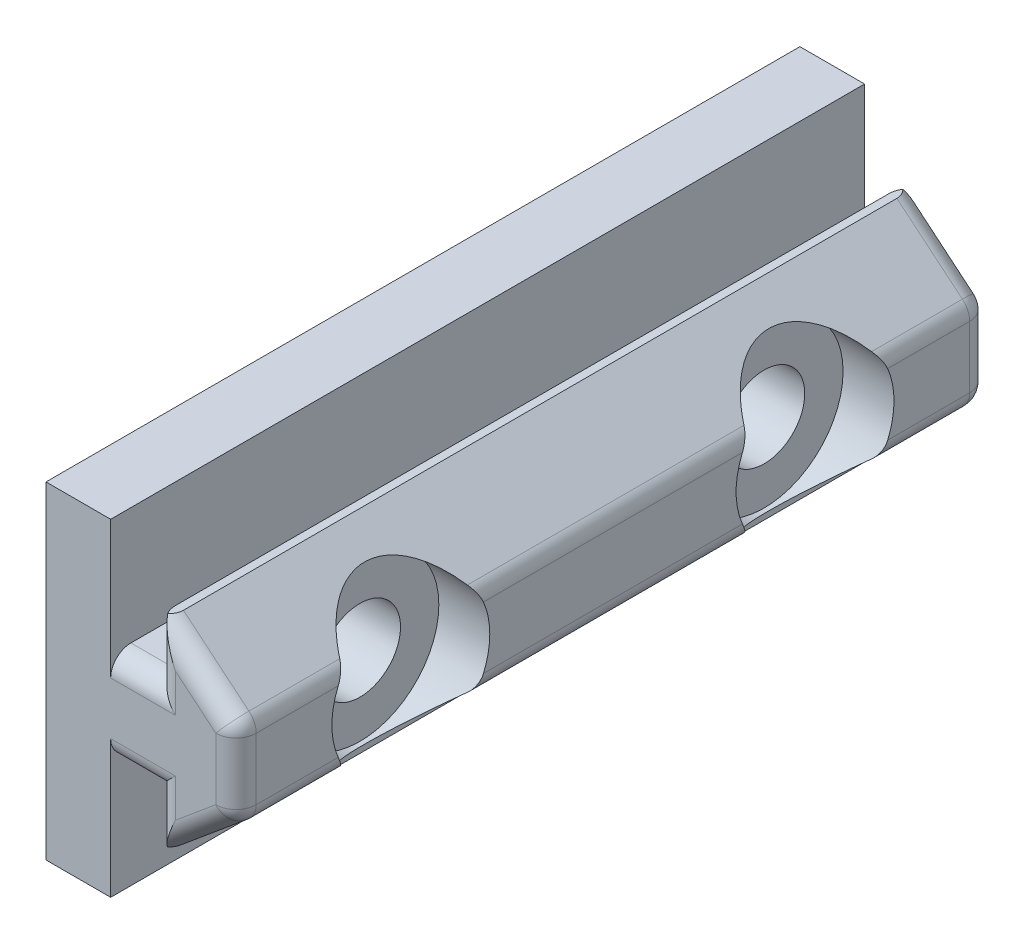
from build123d import *

# Parameters (mm, degrees)
BOSS_EXTRUDE1_DEPTH                             = 47.371
SKETCH2_W                                       = 6.858
SKETCH2_H                                       = 3.429
CUT_EXTRUDE1_DEPTH                              = 49.438972089
SKETCH3_W                                       = 4.064
SKETCH3_H                                       = 47.371
BOSS_EXTRUDE2_DEPTH                             = 7.366
SKETCH4_W                                       = 6.858
SKETCH4_H                                       = 3.429
CUT_EXTRUDE2_DEPTH                              = 50.110425431
SKETCH5_W                                       = 4.064
SKETCH5_H                                       = 47.371
BOSS_EXTRUDE3_DEPTH                             = 7.366
F_3_CLEARANCE_HOLE1_D                           = 2.7686
CBORE_FOR_10_BUTTON_HEAD_CAP_SCREW1_D           = 5.1054
CBORE_FOR_10_BUTTON_HEAD_CAP_SCREW1_CBORE_D     = 9.92124
CBORE_FOR_10_BUTTON_HEAD_CAP_SCREW1_CBORE_DEPTH = 3.2004
FILLET1_R                                       = 1.27
FILLET3_R                                       = 1.27
FILLET5_R                                       = 1.27


with BuildPart() as part:
    # Sketch1 → Boss-Extrude1 (new body)
    with BuildSketch(Plane.XY.offset(23.6855)):
        Polygon((3.302, 6.35), (-4.064, 6.35), (-4.064, -6.35), (3.302, -6.35), (7.874, -2.54), (7.874, 2.54), align=None)
    extrude(amount=-BOSS_EXTRUDE1_DEPTH)

    # Sketch2 → Cut-Extrude1 (cut, through all)
    with BuildSketch(Plane.XY.offset(23.6855)):
        with Locations((-0.635, 4.6355)):
            Rectangle(SKETCH2_W, SKETCH2_H)
    extrude(amount=-CUT_EXTRUDE1_DEPTH, mode=Mode.SUBTRACT)

    # Sketch3 → Boss-Extrude2 (add)
    with BuildSketch(Plane(origin=(0, 2.921, 0), x_dir=(-1, 0, 0), z_dir=(0, 1, 0))):
        with Locations((2.032, 0)):
            Rectangle(SKETCH3_W, SKETCH3_H)
    extrude(amount=BOSS_EXTRUDE2_DEPTH)

    # Sketch4 → Cut-Extrude2 (cut, through all)
    with BuildSketch(Plane.XY.offset(23.6855)):
        with Locations((-0.635, -4.6355)):
            Rectangle(SKETCH4_W, SKETCH4_H)
    extrude(amount=-CUT_EXTRUDE2_DEPTH, mode=Mode.SUBTRACT)

    # Sketch5 → Boss-Extrude3 (add)
    with BuildSketch(Plane.XZ.offset(2.921)):
        with Locations((-2.032, 0)):
            Rectangle(SKETCH5_W, SKETCH5_H)
    extrude(amount=BOSS_EXTRUDE3_DEPTH)

    # #3 Clearance Hole1 (through all)
    with Locations(Plane.ZY.offset(4.064)):
        with Locations((12.7, 0), (-12.7, 0)):
            Hole(F_3_CLEARANCE_HOLE1_D / 2)

    # CBORE for #10 Button Head Cap Screw1 (through all)
    with Locations(Plane(origin=(7.874, 0, 0), x_dir=(0, 0, -1), z_dir=(1, 0, 0))):
        with Locations((-12.7, 0), (12.7, 0)):
            CounterBoreHole(CBORE_FOR_10_BUTTON_HEAD_CAP_SCREW1_D / 2, CBORE_FOR_10_BUTTON_HEAD_CAP_SCREW1_CBORE_D / 2, CBORE_FOR_10_BUTTON_HEAD_CAP_SCREW1_CBORE_DEPTH)

    # Fillet1
    fillet1_edges = [part.edges().sort_by_distance(p)[0] for p in [
        (7.874, -2.54, 20.323251747),
        (7.874, -2.54, -20.323251747),
        (7.874, -2.54, 0),
        (7.874, 2.54, 20.323251747),
        (7.874, 2.54, 0),
        (7.874, 2.54, -20.323251747),
    ]]
    fillet(fillet1_edges, radius=FILLET1_R)

    # Fillet3
    # the kernel refuses this fillet: 1.27 mm, written as the material it takes off along each edge
    with BuildSketch(Plane(origin=(0.862897437, -8.382585469, -23.6855), x_dir=(0, 0, 1), z_dir=(0.7682212795973759, 0.6401843996644799, 0)), Plane(origin=(7.417034188, 2.920804844, -23.6855), x_dir=(0, 0, 1), z_dir=(-0.7682212795973759, 0.6401843996644799, 0))) as fillet3_piece_1:
        with BuildLine():
            CenterArc((FILLET3_R, -FILLET3_R), FILLET3_R, 90, 90)
            Line((0, -FILLET3_R), (0, 0))
            Line((0, 0), (FILLET3_R, 0))
        make_face()
    extrude(amount=8.531574072, mode=Mode.SUBTRACT)
    with BuildSketch(Plane(origin=(6.604, -1.945163819, -23.6855), x_dir=(0.6401843996644796, -0.7682212795973762, 0), z_dir=(-0.7682212795973762, -0.6401843996644796, 0))) as fillet3_piece_2:
        with BuildLine():
            CenterArc((1.27 - FILLET3_R, FILLET3_R), FILLET3_R, 270, 90)
            Line((1.27, FILLET3_R), (1.27, 0))
            Line((1.27, 0), (1.27 - FILLET3_R, 0))
        make_face()
    revolve(axis=Axis((6.604, -1.945163819, -23.6855), (0, 0, 1)), revolution_arc=50.194428908, mode=Mode.SUBTRACT)
    with BuildSketch(Plane(origin=(6.604, 1.945163819, -23.6855), x_dir=(0.6401843996644799, 0.7682212795973757, 0), z_dir=(-0.7682212795973757, 0.6401843996644799, 0))) as fillet3_piece_3:
        with BuildLine():
            CenterArc((1.27 - FILLET3_R, -FILLET3_R), FILLET3_R, 0, 90)
            Line((1.27, -FILLET3_R), (1.27, 0))
            Line((1.27, 0), (1.27 - FILLET3_R, 0))
        make_face()
    revolve(axis=Axis((6.604, 1.945163819, -23.6855), (0, 0, -1)), revolution_arc=50.194428908, mode=Mode.SUBTRACT)
    with BuildSketch(Plane(origin=(2.794, -2.921, -23.6855), x_dir=(0, 0, 1), z_dir=(-1, 0, 0)), Plane(origin=(0, 2.921, -23.6855), x_dir=(0, 0, 1), z_dir=(1, 0, 0))) as fillet3_piece_4:
        with BuildLine():
            CenterArc((FILLET3_R, FILLET3_R), FILLET3_R, 180, 90)
            Line((0, FILLET3_R), (0, 0))
            Line((0, 0), (FILLET3_R, 0))
        make_face()
    extrude(amount=2.794, mode=Mode.SUBTRACT)
    with BuildSketch(Plane(origin=(2.794, 2.921, -23.6855), x_dir=(0, 0, 1), z_dir=(0, 1, 0)), Plane(origin=(2.794, -9.525, -23.6855), x_dir=(0, 0, 1), z_dir=(0, 1, 0))) as fillet3_piece_5:
        with BuildLine():
            CenterArc((FILLET3_R, FILLET3_R), FILLET3_R, 180, 90)
            Line((0, FILLET3_R), (0, 0))
            Line((0, 0), (FILLET3_R, 0))
        make_face()
    extrude(amount=6.604, mode=Mode.SUBTRACT)
    with BuildSketch(Plane(origin=(7.874, -1.945163819, -23.6855), x_dir=(-1, 0, 0), z_dir=(0, 1, 0))) as fillet3_piece_6:
        with BuildLine():
            CenterArc((FILLET3_R, FILLET3_R), FILLET3_R, 180, 90)
            Line((0, FILLET3_R), (0, 0))
            Line((0, 0), (FILLET3_R, 0))
        make_face()
    extrude(amount=3.890327637, mode=Mode.SUBTRACT)
    with BuildSketch(Plane(origin=(2.794, -9.525, -23.6855), x_dir=(0, 0, 1), z_dir=(0, 1, 0))) as fillet3_piece_7a_section:
        with BuildLine():
            CenterArc((FILLET3_R, FILLET3_R), FILLET3_R, 180, 90)
            Line((0, FILLET3_R), (0, 0))
            Line((0, 0), (FILLET3_R, 0))
        make_face()
    fillet3_piece_7a = extrude(amount=9.779, mode=Mode.PRIVATE)
    fillet3_piece_7a = split(fillet3_piece_7a, bisect_by=Plane(origin=(3.081521795, -2.921, -23.397978205), z_dir=(0, 1, 0)), keep=Keep.TOP, mode=Mode.PRIVATE)
    with BuildSketch(Plane(origin=(5.969, -2.921, -23.6855), x_dir=(0, 0, 1), z_dir=(-1, 0, 0))) as fillet3_piece_7b_section:
        with BuildLine():
            CenterArc((FILLET3_R, FILLET3_R), FILLET3_R, 180, 90)
            Line((0, FILLET3_R), (0, 0))
            Line((0, 0), (FILLET3_R, 0))
        make_face()
    fillet3_piece_7b = extrude(amount=5.969, mode=Mode.PRIVATE)
    fillet3_piece_7b = split(fillet3_piece_7b, bisect_by=Plane(origin=(2.794, -2.633478205, -23.397978205), z_dir=(1, 0, 0)), keep=Keep.TOP, mode=Mode.PRIVATE)
    fillet3_piece_7 = fillet3_piece_7a & fillet3_piece_7b
    add(fillet3_piece_7, mode=Mode.SUBTRACT)
    with BuildSketch(Plane(origin=(2.794, -0.254, -23.6855), x_dir=(0, 0, 1), z_dir=(0, 1, 0))) as fillet3_piece_8a_section:
        with BuildLine():
            CenterArc((FILLET3_R, FILLET3_R), FILLET3_R, 180, 90)
            Line((0, FILLET3_R), (0, 0))
            Line((0, 0), (FILLET3_R, 0))
        make_face()
    fillet3_piece_8a = extrude(amount=9.779, mode=Mode.PRIVATE)
    fillet3_piece_8a = split(fillet3_piece_8a, bisect_by=Plane(origin=(3.081521795, 2.921, -23.397978205), z_dir=(0, -1, 0)), keep=Keep.TOP, mode=Mode.PRIVATE)
    with BuildSketch(Plane(origin=(0, 2.921, -23.6855), x_dir=(0, 0, 1), z_dir=(1, 0, 0))) as fillet3_piece_8b_section:
        with BuildLine():
            CenterArc((FILLET3_R, FILLET3_R), FILLET3_R, 180, 90)
            Line((0, FILLET3_R), (0, 0))
            Line((0, 0), (FILLET3_R, 0))
        make_face()
    fillet3_piece_8b = extrude(amount=5.969, mode=Mode.PRIVATE)
    fillet3_piece_8b = split(fillet3_piece_8b, bisect_by=Plane(origin=(2.794, 2.633478205, -23.397978205), z_dir=(1, 0, 0)), keep=Keep.TOP, mode=Mode.PRIVATE)
    fillet3_piece_8 = fillet3_piece_8a & fillet3_piece_8b
    add(fillet3_piece_8, mode=Mode.SUBTRACT)

    # Fillet5
    # the kernel refuses this fillet: 1.27 mm, written as the material it takes off along each edge
    with BuildSketch(Plane(origin=(0.862897437, -8.382585469, 23.6855), x_dir=(-0.6401843996644799, 0.7682212795973759, 0), z_dir=(0.7682212795973759, 0.6401843996644799, 0)), Plane(origin=(7.417034188, 2.920804844, 23.6855), x_dir=(-0.6401843996644799, -0.7682212795973759, 0), z_dir=(-0.7682212795973759, 0.6401843996644799, 0))) as fillet5_piece_1:
        with BuildLine():
            CenterArc((FILLET5_R, -FILLET5_R), FILLET5_R, 90, 90)
            Line((0, -FILLET5_R), (0, 0))
            Line((0, 0), (FILLET5_R, 0))
        make_face()
    extrude(amount=8.531574072, mode=Mode.SUBTRACT)
    with BuildSketch(Plane(origin=(6.604, -1.945163819, 23.6855), x_dir=(1, 0, 0), z_dir=(0, 1, 0))) as fillet5_piece_2:
        with BuildLine():
            CenterArc((1.27 - FILLET5_R, FILLET5_R), FILLET5_R, 270, 90)
            Line((1.27, FILLET5_R), (1.27, 0))
            Line((1.27, 0), (1.27 - FILLET5_R, 0))
        make_face()
    revolve(axis=Axis((6.604, -1.945163819, 23.6855), (0, 0, -1)), revolution_arc=50.194428908, mode=Mode.SUBTRACT)
    with BuildSketch(Plane(origin=(6.604, 1.945163819, 23.6855), x_dir=(0.6401843996644799, 0.7682212795973757, 0), z_dir=(-0.7682212795973757, 0.6401843996644799, 0))) as fillet5_piece_3:
        with BuildLine():
            CenterArc((1.27 - FILLET5_R, FILLET5_R), FILLET5_R, 270, 90)
            Line((1.27, FILLET5_R), (1.27, 0))
            Line((1.27, 0), (1.27 - FILLET5_R, 0))
        make_face()
    revolve(axis=Axis((6.604, 1.945163819, 23.6855), (0, 0, -1)), revolution_arc=50.194428908, mode=Mode.SUBTRACT)
    with BuildSketch(Plane(origin=(2.794, 2.921, 23.6855), x_dir=(1, 0, 0), z_dir=(0, 1, 0)), Plane(origin=(2.794, -9.525, 23.6855), x_dir=(1, 0, 0), z_dir=(0, 1, 0))) as fillet5_piece_4:
        with BuildLine():
            CenterArc((FILLET5_R, FILLET5_R), FILLET5_R, 180, 90)
            Line((0, FILLET5_R), (0, 0))
            Line((0, 0), (FILLET5_R, 0))
        make_face()
    extrude(amount=6.604, mode=Mode.SUBTRACT)
    with BuildSketch(Plane(origin=(0, 2.921, 23.6855), x_dir=(0, -1, 0), z_dir=(1, 0, 0)), Plane(origin=(2.794, -2.921, 23.6855), x_dir=(0, 1, 0), z_dir=(-1, 0, 0))) as fillet5_piece_5:
        with BuildLine():
            CenterArc((FILLET5_R, FILLET5_R), FILLET5_R, 180, 90)
            Line((0, FILLET5_R), (0, 0))
            Line((0, 0), (FILLET5_R, 0))
        make_face()
    extrude(amount=2.794, mode=Mode.SUBTRACT)
    with BuildSketch(Plane(origin=(7.874, -1.945163819, 23.6855), x_dir=(-1, 0, 0), z_dir=(0, 1, 0))) as fillet5_piece_6:
        with BuildLine():
            CenterArc((FILLET5_R, -FILLET5_R), FILLET5_R, 90, 90)
            Line((0, -FILLET5_R), (0, 0))
            Line((0, 0), (FILLET5_R, 0))
        make_face()
    extrude(amount=3.890327637, mode=Mode.SUBTRACT)
    with BuildSketch(Plane(origin=(2.794, -0.254, 23.6855), x_dir=(1, 0, 0), z_dir=(0, 1, 0))) as fillet5_piece_7a_section:
        with BuildLine():
            CenterArc((FILLET5_R, FILLET5_R), FILLET5_R, 180, 90)
            Line((0, FILLET5_R), (0, 0))
            Line((0, 0), (FILLET5_R, 0))
        make_face()
    fillet5_piece_7a = extrude(amount=9.779, mode=Mode.PRIVATE)
    fillet5_piece_7a = split(fillet5_piece_7a, bisect_by=Plane(origin=(3.081521795, 2.921, 23.397978205), z_dir=(0, -1, 0)), keep=Keep.TOP, mode=Mode.PRIVATE)
    with BuildSketch(Plane(origin=(0, 2.921, 23.6855), x_dir=(0, -1, 0), z_dir=(1, 0, 0))) as fillet5_piece_7b_section:
        with BuildLine():
            CenterArc((FILLET5_R, FILLET5_R), FILLET5_R, 180, 90)
            Line((0, FILLET5_R), (0, 0))
            Line((0, 0), (FILLET5_R, 0))
        make_face()
    fillet5_piece_7b = extrude(amount=5.969, mode=Mode.PRIVATE)
    fillet5_piece_7b = split(fillet5_piece_7b, bisect_by=Plane(origin=(2.794, 2.633478205, 23.397978205), z_dir=(1, 0, 0)), keep=Keep.TOP, mode=Mode.PRIVATE)
    fillet5_piece_7 = fillet5_piece_7a & fillet5_piece_7b
    add(fillet5_piece_7, mode=Mode.SUBTRACT)
    with BuildSketch(Plane(origin=(2.794, -9.525, 23.6855), x_dir=(1, 0, 0), z_dir=(0, 1, 0))) as fillet5_piece_8a_section:
        with BuildLine():
            CenterArc((FILLET5_R, FILLET5_R), FILLET5_R, 180, 90)
            Line((0, FILLET5_R), (0, 0))
            Line((0, 0), (FILLET5_R, 0))
        make_face()
    fillet5_piece_8a = extrude(amount=9.779, mode=Mode.PRIVATE)
    fillet5_piece_8a = split(fillet5_piece_8a, bisect_by=Plane(origin=(3.081521795, -2.921, 23.397978205), z_dir=(0, 1, 0)), keep=Keep.TOP, mode=Mode.PRIVATE)
    with BuildSketch(Plane(origin=(5.969, -2.921, 23.6855), x_dir=(0, 1, 0), z_dir=(-1, 0, 0))) as fillet5_piece_8b_section:
        with BuildLine():
            CenterArc((FILLET5_R, FILLET5_R), FILLET5_R, 180, 90)
            Line((0, FILLET5_R), (0, 0))
            Line((0, 0), (FILLET5_R, 0))
        make_face()
    fillet5_piece_8b = extrude(amount=5.969, mode=Mode.PRIVATE)
    fillet5_piece_8b = split(fillet5_piece_8b, bisect_by=Plane(origin=(2.794, -2.633478205, 23.397978205), z_dir=(1, 0, 0)), keep=Keep.TOP, mode=Mode.PRIVATE)
    fillet5_piece_8 = fillet5_piece_8a & fillet5_piece_8b
    add(fillet5_piece_8, mode=Mode.SUBTRACT)


solid = part.part
